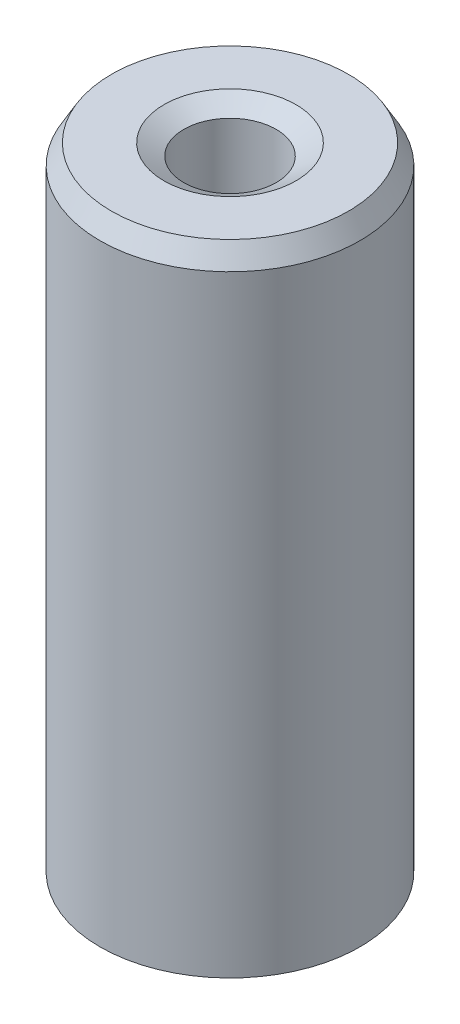
from build123d import *
from OCP.BRepFilletAPI import BRepFilletAPI_MakeChamfer

# Parameters (mm, degrees)
SKETCH1_R           = 12.5
BOSS_EXTRUDE1_DEPTH = 61.812917588
SKETCH2_R           = 4.440587009
CUT_EXTRUDE1_DEPTH  = 65.291031884
CHAMFER1_SIZE       = 1.908470838
CHAMFER1_SIZE2      = 1.102172911


with BuildPart() as part:
    # Sketch1 → Boss-Extrude1 (new body)
    with BuildSketch(Plane(origin=(0, 0, 0), x_dir=(1, 0, 0), z_dir=(0, 1, 0))):
        Circle(SKETCH1_R)
    extrude(amount=BOSS_EXTRUDE1_DEPTH)

    # Sketch2 → Cut-Extrude1 (cut, through all)
    with BuildSketch(Plane(origin=(0, 0, 0), x_dir=(1, 0, 0), z_dir=(0, 1, 0))):
        Circle(SKETCH2_R)
    extrude(amount=CUT_EXTRUDE1_DEPTH, mode=Mode.SUBTRACT)

    # Chamfer1: one chamfer whose edges measure the first distance from different faces: ONE call of the kernel's chamfer builder (chamfer() names one face for all edges)
    chamfer1_edges_1 = [part.edges().sort_by_distance(p)[0] for p in [
        (-4.440587009, 61.812917588, 0),
    ]]
    chamfer1_side_1 = [part.faces().sort_by_distance(p)[0] for p in [
        (-12.146446609, 61.812917588, 0),
    ]]
    chamfer1_edges_2 = [part.edges().sort_by_distance(p)[0] for p in [
        (-4.440587009, 0, 0),
    ]]
    chamfer1_side_2 = [part.faces().sort_by_distance(p)[0] for p in [
        (-4.440587009, 30.906458794, 0),
    ]]
    chamfer1_edges_3 = [part.edges().sort_by_distance(p)[0] for p in [
        (-12.5, 0, 0),
    ]]
    chamfer1_side_3 = [part.faces().sort_by_distance(p)[0] for p in [
        (-12.146446609, 0, 0),
    ]]
    chamfer1_edges_4 = [part.edges().sort_by_distance(p)[0] for p in [
        (-12.5, 61.812917588, 0),
    ]]
    chamfer1_side_4 = [part.faces().sort_by_distance(p)[0] for p in [
        (-12.5, 30.906458794, 0),
    ]]
    chamfer1 = BRepFilletAPI_MakeChamfer(part.part.solid().wrapped)
    for e in chamfer1_edges_1:
        chamfer1.Add(CHAMFER1_SIZE, CHAMFER1_SIZE2, e.wrapped, chamfer1_side_1[0].wrapped)  # the first distance lies on this face
    for e in chamfer1_edges_2:
        chamfer1.Add(CHAMFER1_SIZE, CHAMFER1_SIZE2, e.wrapped, chamfer1_side_2[0].wrapped)  # the first distance lies on this face
    for e in chamfer1_edges_3:
        chamfer1.Add(CHAMFER1_SIZE, CHAMFER1_SIZE2, e.wrapped, chamfer1_side_3[0].wrapped)  # the first distance lies on this face
    for e in chamfer1_edges_4:
        chamfer1.Add(CHAMFER1_SIZE, CHAMFER1_SIZE2, e.wrapped, chamfer1_side_4[0].wrapped)  # the first distance lies on this face
    add(Compound.cast(chamfer1.Shape()), mode=Mode.REPLACE)


solid = part.part
